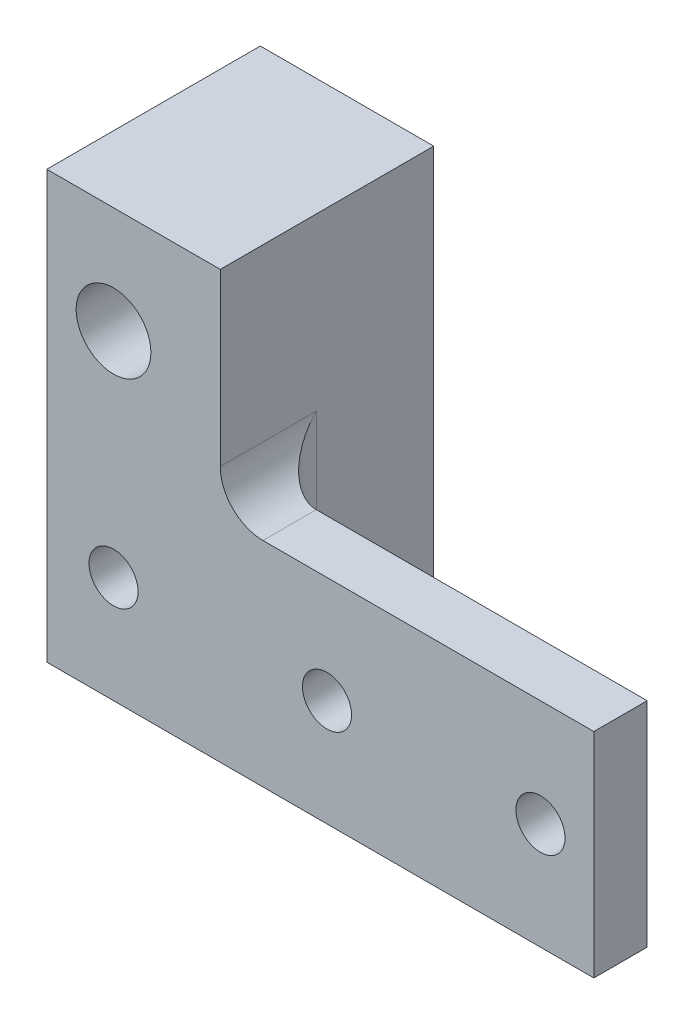
from build123d import *

# Parameters (mm, degrees)
BOSS_EXTRUDE1_DEPTH = 25.4
SKETCH2_R           = 2.921
CUT_EXTRUDE1_DEPTH  = 91.02678768
SKETCH3_W           = 4.7625
SKETCH3_H           = 50.8
CUT_EXTRUDE2_DEPTH  = 91.02678768
SKETCH4_W           = 44.45
SKETCH4_H           = 19.05
CUT_EXTRUDE3_DEPTH  = 91.02678768
FILLET1_R           = 5.08
SKETCH6_R           = 4.445
CUT_EXTRUDE5_DEPTH  = 12.7


with BuildPart() as part:
    # Sketch1 → Boss-Extrude1 (new body)
    with BuildSketch(Plane.XY):
        Polygon((0, 0), (0, 50.8), (25.4, 50.8), (25.4, 25.4), (69.85, 25.4), (69.85, 0), align=None)
    extrude(amount=BOSS_EXTRUDE1_DEPTH)

    # Sketch2 → Cut-Extrude1 (cut, through all)
    with BuildSketch(Plane.XY.offset(25.4)):
        with Locations((12.7, 38.1)):
            Circle(SKETCH2_R)
        with Locations((12.7, 12.7)):
            Circle(SKETCH2_R)
        with Locations((38.1, 12.7)):
            Circle(SKETCH2_R)
        with Locations((63.5, 12.7)):
            Circle(SKETCH2_R)
    extrude(amount=-CUT_EXTRUDE1_DEPTH, mode=Mode.SUBTRACT)

    # Sketch3 → Cut-Extrude2 (cut, through all)
    with BuildSketch(Plane.XY.offset(25.4)):
        with Locations((2.38125, 25.4)):
            Rectangle(SKETCH3_W, SKETCH3_H)
    extrude(amount=-CUT_EXTRUDE2_DEPTH, mode=Mode.SUBTRACT)

    # Sketch4 → Cut-Extrude3 (cut, through all)
    with BuildSketch(Plane.XZ):
        with Locations((47.625, 9.525)):
            Rectangle(SKETCH4_W, SKETCH4_H)
    extrude(amount=-CUT_EXTRUDE3_DEPTH, mode=Mode.SUBTRACT)

    # Fillet1
    fillet1_edges = [part.edges().sort_by_distance(p)[0] for p in [
        (25.4, 12.7, 19.05),
        (25.4, 25.4, 22.225),
    ]]
    fillet(fillet1_edges, radius=FILLET1_R)

    # Sketch6 → Cut-Extrude5 (cut)
    with BuildSketch(Plane.XY.offset(25.4)):
        with Locations((12.7, 38.1)):
            Circle(SKETCH6_R)
    extrude(amount=-CUT_EXTRUDE5_DEPTH, mode=Mode.SUBTRACT)


solid = part.part
